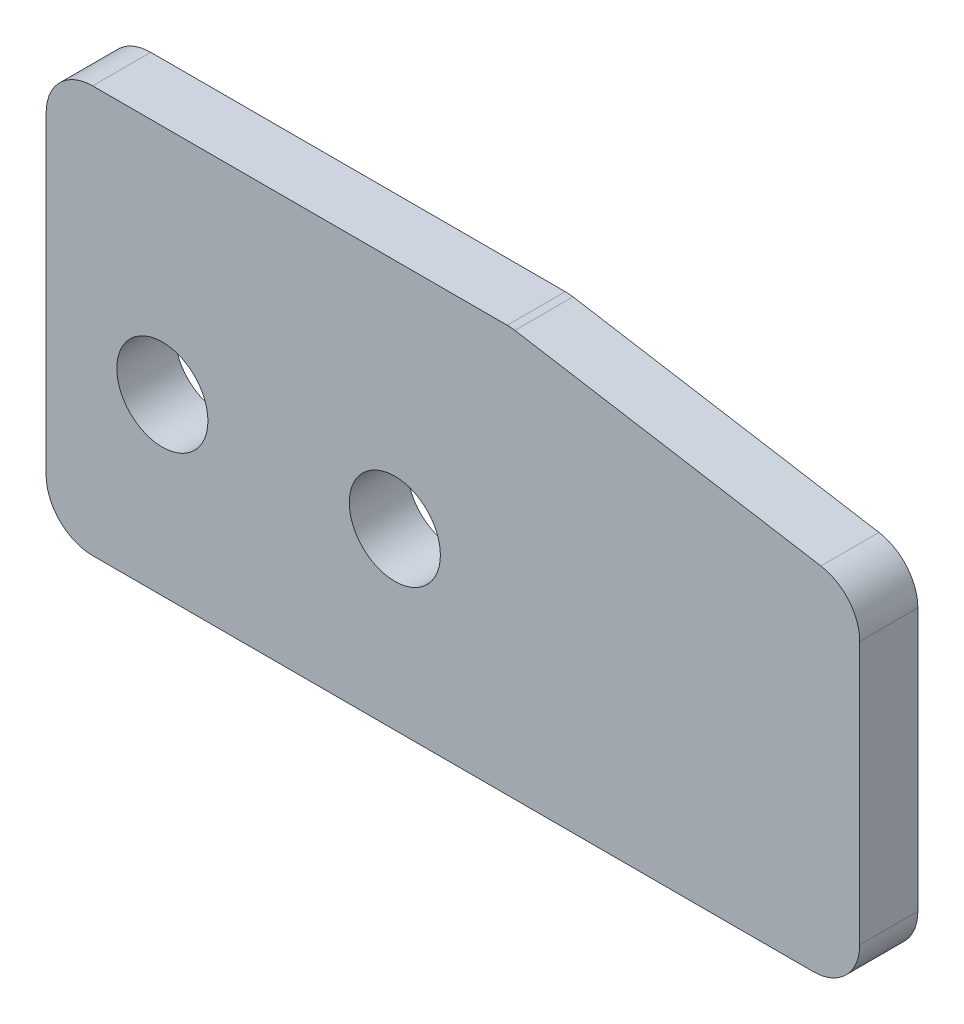
from build123d import *

# Parameters (mm, degrees)
SKETCH3_R           = 2.4892
BOSS_EXTRUDE1_DEPTH = 3.175
FILLET2_R           = 2.54


with BuildPart() as part:
    # Sketch3 → Boss-Extrude1 (new body)
    with BuildSketch(Plane.XY):
        Polygon((19.05, 709.611738), (19.05, 706.436738), (19.05, 687.386738), (44.45, 687.386738), (63.5, 687.386738), (63.5, 706.436738), (44.45, 709.611738), align=None)
        with Locations((25.4, 696.911738)):
            Circle(SKETCH3_R, mode=Mode.SUBTRACT)
        with Locations((38.1, 696.911738)):
            Circle(SKETCH3_R, mode=Mode.SUBTRACT)
    extrude(amount=-BOSS_EXTRUDE1_DEPTH)

    # Fillet2
    fillet2_edges = [part.edges().sort_by_distance(p)[0] for p in [
        (44.45, 709.611738, -1.5875),
        (19.05, 687.386738, -1.5875),
        (63.5, 687.386738, -1.5875),
        (63.5, 706.436738, -1.5875),
        (19.05, 709.611738, -1.5875),
    ]]
    fillet(fillet2_edges, radius=FILLET2_R)


solid = part.part
